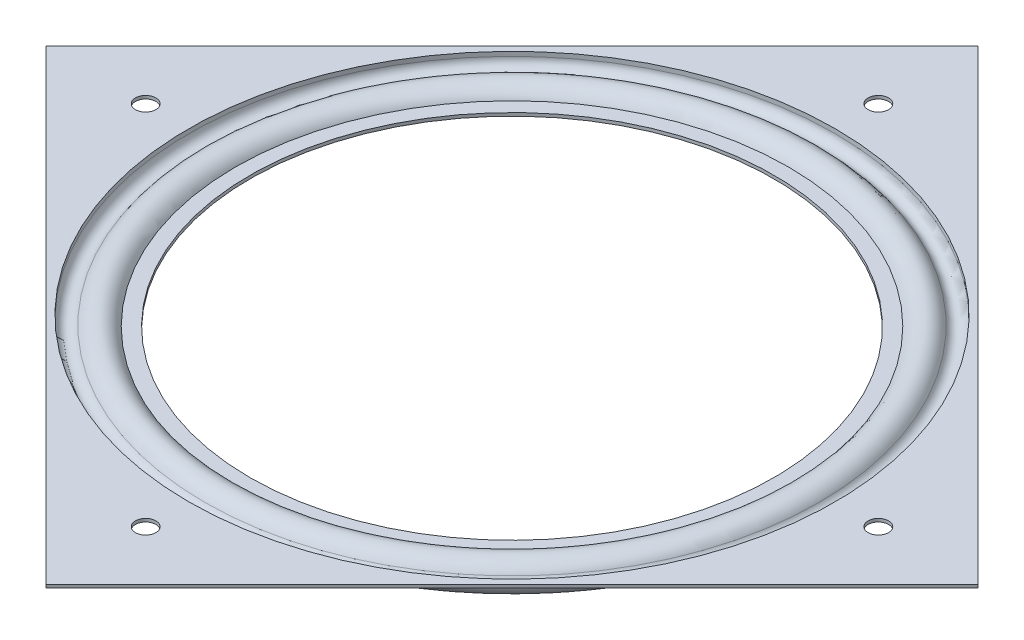
from build123d import *

# Parameters (mm, degrees)
SKETCH2_W                                 = 154.0002
SKETCH2_H                                 = 154.0002
SKETCH2_R                                 = 75.529340861
EXTRUDE1_DEPTH                            = 0.7366
EXTRUDE2_START                            = -0.7366
SKETCH3_R                                 = 75.529340861
EXTRUDE2_DEPTH                            = 0.7366
CIRPATTERN1_COUNT                         = 6
SKETCH5_W                                 = 3.3782
SKETCH5_H                                 = 0.7366
F_5_32_0_156250_DIAMETER_HOLE1_AT_2_COUNT = 2
F_5_32_0_156250_DIAMETER_HOLE1_AT_2_PITCH = 141.3002
F_5_32_0_156250_DIAMETER_HOLE1_AT_3_COUNT = 2
F_5_32_0_156250_DIAMETER_HOLE1_AT_3_PITCH = 141.3002
F_5_32_0_156250_DIAMETER_HOLE1_AT_4_COUNT = 2
F_5_32_0_156250_DIAMETER_HOLE1_AT_4_PITCH = 199.828659206
SKETCH7_W                                 = 2.3876
SKETCH7_H                                 = 8.128
F_5_32_0_156250_DIAMETER_HOLE2_AT_2_COUNT = 2
F_5_32_0_156250_DIAMETER_HOLE2_AT_2_PITCH = 121.0564
F_5_32_0_156250_DIAMETER_HOLE2_AT_3_COUNT = 2
F_5_32_0_156250_DIAMETER_HOLE2_AT_3_PITCH = 171.199602692
F_5_32_0_156250_DIAMETER_HOLE2_AT_4_COUNT = 2
F_5_32_0_156250_DIAMETER_HOLE2_AT_4_PITCH = 121.0564
CIRPATTERN2_COUNT                         = 4


with BuildPart() as part:
    # Sketch1 → Revolve-Thin4 (revolve)
    with BuildSketch(Plane.XY, mode=Mode.PRIVATE) as revolve_thin4_sk:
        with BuildLine():
            Line((62.74854946, 1.778), (61.214, 1.778))
            ThreePointArc((61.214, 1.778), (59.436, 0), (61.214, -1.778))
            Line((61.214, -1.778), (64.28309892, -1.778))
            ThreePointArc((64.28309892, -1.778), (67.669225582, -4.788771381), (71.737577241, -2.794))
            ThreePointArc((71.737577241, -2.794), (74.023261161, -1.847238721), (75.529340861, -3.81))
            Line((75.529340861, -3.81), (75.529340861, -4.826))
            Line((75.529340861, -4.826), (77.0001, -4.826))
            Line((77.0001, -4.826), (77.0001, -4.0894))
            Line((77.0001, -4.0894), (76.265940861, -4.0894))
            Line((76.265940861, -4.0894), (76.265940861, -3.81))
            ThreePointArc((76.265940861, -3.81), (74.21390727, -1.135737757), (71.099662929, -2.4257))
            ThreePointArc((71.099662929, -2.4257), (67.492675346, -4.00937161), (64.902401285, -1.0414))
            Line((64.902401285, -1.0414), (61.214, -1.0414))
            ThreePointArc((61.214, -1.0414), (60.1726, 0), (61.214, 1.0414))
            Line((61.214, 1.0414), (62.74854946, 1.0414))
            Line((62.74854946, 1.0414), (62.74854946, 1.778))
        make_face()
    revolve(revolve_thin4_sk.sketch.rotate(Axis((0, 21.71272626, 0), (0, -1, 0)), 90), axis=Axis((0, 21.71272626, 0), (0, -1, 0)))

    # Sketch2 → Extrude1 (add)
    with BuildSketch(Plane.XZ.offset(4.826)):
        Rectangle(SKETCH2_W, SKETCH2_H)
        with Locations(Location((0, 0, 0), (0, 0, 90))):
            Circle(SKETCH2_R, mode=Mode.SUBTRACT)
    extrude(amount=-EXTRUDE1_DEPTH)

    # Sketch5 → 5/32 (0.156250) Diameter Hole1 (revolve, cut)
    with BuildSketch(Plane(origin=(70.6501, -4.0894, -70.6501), x_dir=(0, 0, 1), z_dir=(1, 0, 0))):
        with Locations((1.6891, 0.3683)):
            Rectangle(SKETCH5_W, SKETCH5_H)
    f_5_32_0_156250_diameter_hole1 = revolve(axis=Axis((70.6501, 2.2606, -70.6501), (0, -1, 0)), mode=Mode.SUBTRACT)

    # 5/32 (0.156250) Diameter Hole1 at 2: 5/32 (0.156250) Diameter Hole1 ×2
    with Locations(*[(0, 0, i * F_5_32_0_156250_DIAMETER_HOLE1_AT_2_PITCH) for i in range(1, F_5_32_0_156250_DIAMETER_HOLE1_AT_2_COUNT)]):
        add(f_5_32_0_156250_diameter_hole1, mode=Mode.SUBTRACT)

    # 5/32 (0.156250) Diameter Hole1 at 3: 5/32 (0.156250) Diameter Hole1 ×2
    with Locations(*[(-i * F_5_32_0_156250_DIAMETER_HOLE1_AT_3_PITCH, 0, 0) for i in range(1, F_5_32_0_156250_DIAMETER_HOLE1_AT_3_COUNT)]):
        add(f_5_32_0_156250_diameter_hole1, mode=Mode.SUBTRACT)

    # 5/32 (0.156250) Diameter Hole1 at 4: 5/32 (0.156250) Diameter Hole1 ×2
    with Locations(*[Vector(-0.7071067811865476, 0, 0.7071067811865476) * (i * F_5_32_0_156250_DIAMETER_HOLE1_AT_4_PITCH) for i in range(1, F_5_32_0_156250_DIAMETER_HOLE1_AT_4_COUNT)]):
        add(f_5_32_0_156250_diameter_hole1, mode=Mode.SUBTRACT)

    # Sketch11 → 3/32 (0.093750) Diameter Hole2 (revolve, cut)
    with BuildSketch(Plane(origin=(-70.2437, -4.0894, -61.1251), x_dir=(0, 0, 1), z_dir=(1, 0, 0))):
        Polygon((0, 0), (0, 26.115399675), (1.190625, 25.4), (1.190625, 0), align=None)
    f_3_32_0_093750_diameter_hole2 = revolve(axis=Axis((-70.2437, 2.2606, -61.1251), (0, -1, 0)), mode=Mode.SUBTRACT)

    # CirPattern2: 3/32 (0.093750) Diameter Hole2 ×4 about axis
    cirpattern2_axis = Axis((0, 0, 0), (0, 1, 0))
    for i in range(1, CIRPATTERN2_COUNT):
        add(f_3_32_0_093750_diameter_hole2.rotate(cirpattern2_axis, i * 360 / CIRPATTERN2_COUNT), mode=Mode.SUBTRACT)


with BuildPart() as body_2:
    # Sketch1<5> → Revolve-Thin5 (revolve)
    with BuildSketch(Plane.XY, mode=Mode.PRIVATE) as revolve_thin5_sk:
        with BuildLine():
            Line((61.214, 1.0414), (64.576093872, 1.0414))
            ThreePointArc((64.576093872, 1.0414), (68.088390067, 3.299931105), (71.737577241, 1.27))
            ThreePointArc((71.737577241, 1.27), (74.023261161, 0.323238721), (75.529340861, 2.286))
            Line((75.529340861, 2.286), (75.529340861, 3.302))
            Line((75.529340861, 3.302), (77.0001, 3.302))
            Line((77.0001, 3.302), (77.0001, 2.5654))
            Line((77.0001, 2.5654), (76.265940861, 2.5654))
            Line((76.265940861, 2.5654), (76.265940861, 2.286))
            ThreePointArc((76.265940861, 2.286), (74.21390727, -0.388262243), (71.099662929, 0.9017))
            ThreePointArc((71.099662929, 0.9017), (67.890458911, 2.54923464), (65.066299927, 0.3048))
            Line((65.066299927, 0.3048), (61.214, 0.3048))
            Line((61.214, 0.3048), (61.214, 1.0414))
        make_face()
    revolve(revolve_thin5_sk.sketch.rotate(Axis((0, 21.71272626, 0), (0, -1, 0)), 90), axis=Axis((0, 21.71272626, 0), (0, -1, 0)))

    # Sketch3 → Extrude2 (add)
    with BuildSketch(Plane(origin=(0, 3.302, 0), x_dir=(-1, 0, 0), z_dir=(0, 1, 0)).offset(EXTRUDE2_START)):
        Polygon((0, -108.894585724), (108.894585724, 0), (0, 108.894585724), (-108.894585724, 0), align=None)
        with Locations(Location((0, 0, 0), (0, 0, 90))):
            Circle(SKETCH3_R, mode=Mode.SUBTRACT)
    extrude(amount=EXTRUDE2_DEPTH)

    # Sketch7 → 5/32 (0.156250) Diameter Hole2 (revolve, cut)
    with BuildSketch(Plane(origin=(85.599801346, 3.302, 0), x_dir=(0, 0, 1), z_dir=(1, 0, 0))):
        with Locations((1.1938, 4.064)):
            Rectangle(SKETCH7_W, SKETCH7_H)
    f_5_32_0_156250_diameter_hole2 = revolve(axis=Axis((85.599801346, 9.652, 0), (0, -1, 0)), mode=Mode.SUBTRACT)

    # 5/32 (0.156250) Diameter Hole2 at 2: 5/32 (0.156250) Diameter Hole2 ×2
    with Locations(*[Vector(-0.7071067811865476, 0, -0.7071067811865476) * (i * F_5_32_0_156250_DIAMETER_HOLE2_AT_2_PITCH) for i in range(1, F_5_32_0_156250_DIAMETER_HOLE2_AT_2_COUNT)]):
        add(f_5_32_0_156250_diameter_hole2, mode=Mode.SUBTRACT)

    # 5/32 (0.156250) Diameter Hole2 at 3: 5/32 (0.156250) Diameter Hole2 ×2
    with Locations(*[(-i * F_5_32_0_156250_DIAMETER_HOLE2_AT_3_PITCH, 0, 0) for i in range(1, F_5_32_0_156250_DIAMETER_HOLE2_AT_3_COUNT)]):
        add(f_5_32_0_156250_diameter_hole2, mode=Mode.SUBTRACT)

    # 5/32 (0.156250) Diameter Hole2 at 4: 5/32 (0.156250) Diameter Hole2 ×2
    with Locations(*[Vector(-0.7071067811865476, 0, 0.7071067811865476) * (i * F_5_32_0_156250_DIAMETER_HOLE2_AT_4_PITCH) for i in range(1, F_5_32_0_156250_DIAMETER_HOLE2_AT_4_COUNT)]):
        add(f_5_32_0_156250_diameter_hole2, mode=Mode.SUBTRACT)


with BuildPart() as body_3:
    # Sketch4 → Revolve1 (revolve)
    with BuildSketch(Plane.XY):
        with BuildLine():
            Line((68.21805, 2.5146), (68.21805, -4.0386))
            ThreePointArc((68.21805, -4.0386), (71.49465, -0.762), (68.21805, 2.5146))
        make_face()
    revolve(axis=Axis((68.21805, 2.837450101, 0), (0, -1, 0)))


with BuildPart() as cirpattern1_1:
    # CirPattern1: pattern copy
    add(body_3.part.rotate(Axis((0, 0, 0), (0, 1, 0)), 1 * 360 / CIRPATTERN1_COUNT))


with BuildPart() as cirpattern1_2:
    # CirPattern1: pattern copy
    add(body_3.part.rotate(Axis((0, 0, 0), (0, 1, 0)), 2 * 360 / CIRPATTERN1_COUNT))


with BuildPart() as cirpattern1_3:
    # CirPattern1: pattern copy
    add(body_3.part.rotate(Axis((0, 0, 0), (0, 1, 0)), 3 * 360 / CIRPATTERN1_COUNT))


with BuildPart() as cirpattern1_4:
    # CirPattern1: pattern copy
    add(body_3.part.rotate(Axis((0, 0, 0), (0, 1, 0)), 4 * 360 / CIRPATTERN1_COUNT))


with BuildPart() as cirpattern1_5:
    # CirPattern1: pattern copy
    add(body_3.part.rotate(Axis((0, 0, 0), (0, 1, 0)), 5 * 360 / CIRPATTERN1_COUNT))


solid = Compound([body_2.part, body_3.part, cirpattern1_1.part, cirpattern1_2.part, cirpattern1_3.part, cirpattern1_4.part, cirpattern1_5.part])
